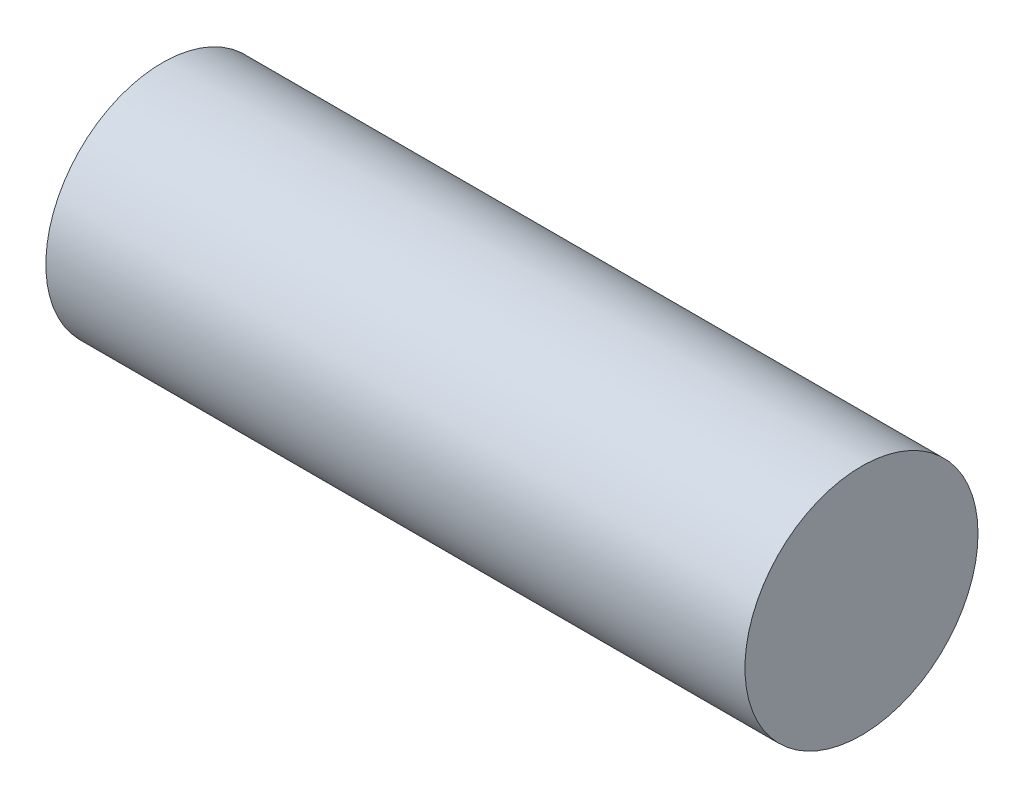
from build123d import *

# Parameters (mm, degrees)
SKETCH1_R           = 38.1
BOSS_EXTRUDE1_DEPTH = 228.6


with BuildPart() as part:
    # Sketch1 → Boss-Extrude1 (new body)
    with BuildSketch(Plane(origin=(0, 0, 0), x_dir=(0, 0, -1), z_dir=(1, 0, 0))):
        Circle(SKETCH1_R)
    extrude(amount=BOSS_EXTRUDE1_DEPTH)


solid = part.part
